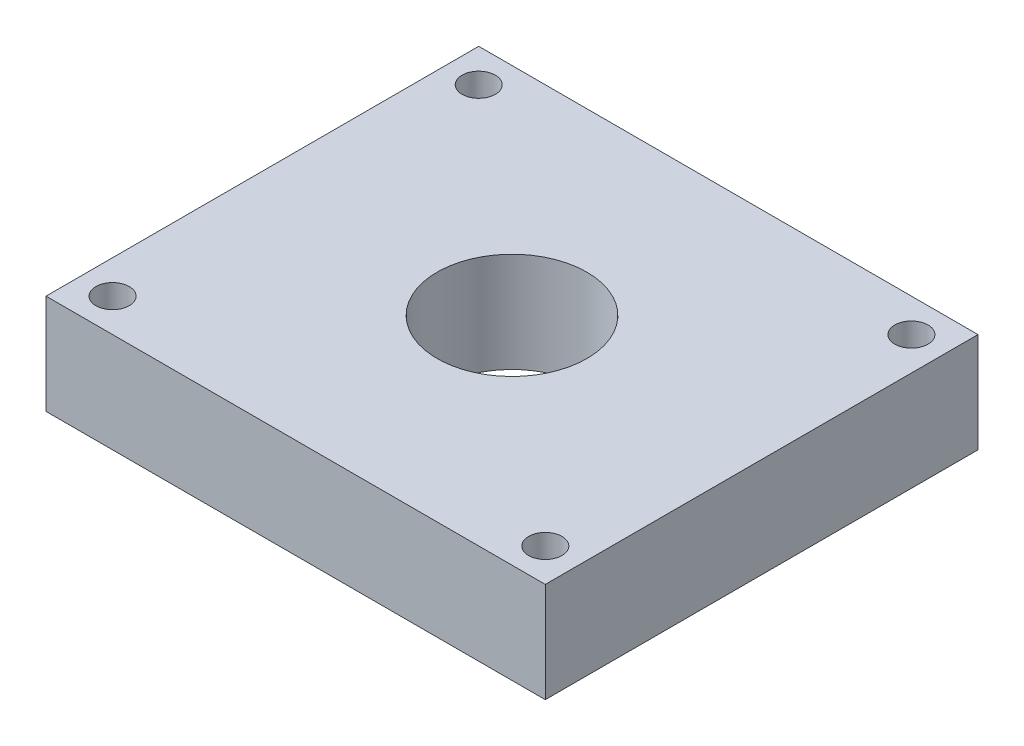
from build123d import *

# Parameters (mm, degrees)
SKETCH1_W           = 95.25
SKETCH1_H           = 82.55
SKETCH1_R           = 14.2875
SKETCH1_R_2         = 3.175
BOSS_EXTRUDE1_DEPTH = 19.05


with BuildPart() as part:
    # Sketch1 → Boss-Extrude1 (new body)
    with BuildSketch(Plane(origin=(0, 0, 0), x_dir=(1, 0, 0), z_dir=(0, 1, 0))):
        Rectangle(SKETCH1_W, SKETCH1_H)
        Circle(SKETCH1_R, mode=Mode.SUBTRACT)
        with Locations((-41.275, 34.925)):
            Circle(SKETCH1_R_2, mode=Mode.SUBTRACT)
        with Locations((-41.275, -34.925)):
            Circle(SKETCH1_R_2, mode=Mode.SUBTRACT)
        with Locations((41.275, 34.925)):
            Circle(SKETCH1_R_2, mode=Mode.SUBTRACT)
        with Locations((41.275, -34.925)):
            Circle(SKETCH1_R_2, mode=Mode.SUBTRACT)
    extrude(amount=BOSS_EXTRUDE1_DEPTH)


solid = part.part
